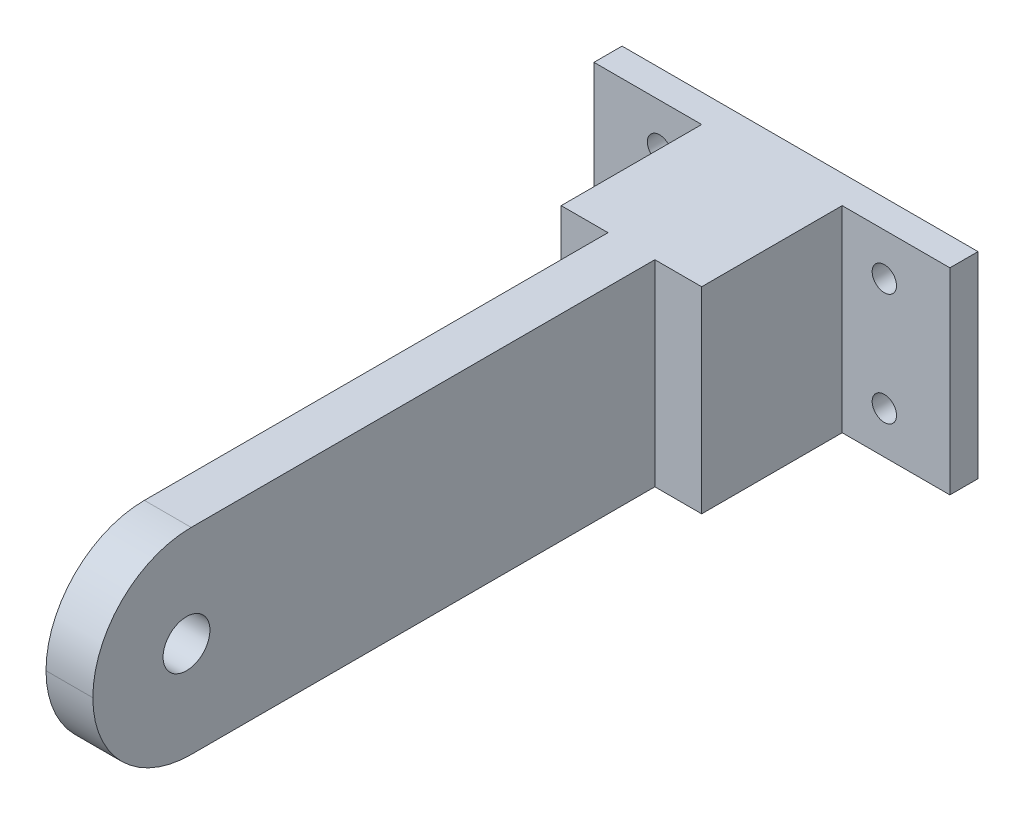
from build123d import *

# Parameters (mm, degrees)
SKETCH_1_W             = 38
SKETCH_1_H             = 21
EXTRUDE_1_DEPTH        = 3
SKETCH_2_R             = 1.3
CUT_EXTRUDE_1_DEPTH    = 3
PATTERN_LINEAR_1_COUNT = 2
PATTERN_LINEAR_1_PITCH = 24
SKETCH_3_W             = 15
SKETCH_3_H             = 21
EXTRUDE_2_DEPTH        = 15
SKETCH_4_W             = 5
SKETCH_4_H             = 21
EXTRUDE_3_DEPTH        = 60
SKETCH_5_R             = 2.5
CUT_EXTRUDE_2_DEPTH    = 60
FILLET_1_R             = 10.5


with BuildPart() as part:
    # 草图1 → 凸台-拉伸1 (new body)
    with BuildSketch(Plane.XY):
        with Locations((-8.78974359, -2.405128205)):
            Rectangle(SKETCH_1_W, SKETCH_1_H)
    extrude(amount=EXTRUDE_1_DEPTH)

    # 草图2 → 切除-拉伸1 (cut)
    with BuildSketch(Plane.XY.offset(3)):
        with Locations((-20.78974359, 3.594871795)):
            Circle(SKETCH_2_R)
        with Locations((-20.78974359, -8.405128205)):
            Circle(SKETCH_2_R)
    cut_extrude_1 = extrude(amount=-CUT_EXTRUDE_1_DEPTH, mode=Mode.SUBTRACT)

    # 阵列(线性)1: 切除-拉伸1 ×2
    with Locations(*[(i * PATTERN_LINEAR_1_PITCH, 0, 0) for i in range(1, PATTERN_LINEAR_1_COUNT)]):
        add(cut_extrude_1, mode=Mode.SUBTRACT)

    # 草图3 → 凸台-拉伸2 (add)
    with BuildSketch(Plane.XY.offset(3)):
        with Locations((-8.78974359, -2.405128205)):
            Rectangle(SKETCH_3_W, SKETCH_3_H)
    extrude(amount=EXTRUDE_2_DEPTH)

    # 草图4 → 凸台-拉伸3 (add)
    with BuildSketch(Plane.XY.offset(18)):
        with Locations((-8.78974359, -2.405128205)):
            Rectangle(SKETCH_4_W, SKETCH_4_H)
    extrude(amount=EXTRUDE_3_DEPTH)

    # 草图5 → 切除-拉伸2 (cut)
    with BuildSketch(Plane(origin=(-6.28974359, 0, 0), x_dir=(0, 0, -1), z_dir=(1, 0, 0))):
        with Locations(Location((-68, -2.405128205, 0), (0, 0, 90))):
            Circle(SKETCH_5_R)
    extrude(amount=-CUT_EXTRUDE_2_DEPTH, mode=Mode.SUBTRACT)

    # 圆角1
    fillet_1_edges = [part.edges().sort_by_distance(p)[0] for p in [
        (-8.78974359, 8.094871795, 78),
        (-8.78974359, -12.905128205, 78),
    ]]
    fillet(fillet_1_edges, radius=FILLET_1_R - 0.0001)  # a hair under: the kernel refuses the full size


solid = part.part
